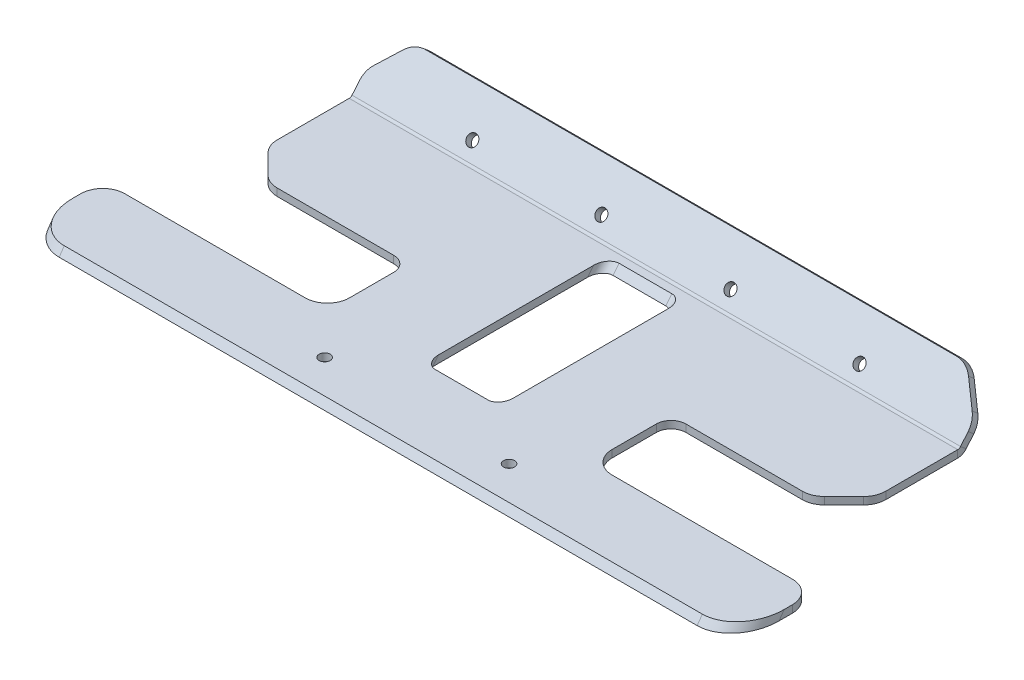
from build123d import *

# Parameters (mm, degrees)
SKETCH_1_W              = 165
SKETCH_1_H              = 108
EXTRUDE_1_DEPTH         = 3
SHEET_METAL_2_OUTLINE_W = 165
SHEET_METAL_2_OUTLINE_H = 108
SHEET_METAL_2_DEPTH     = 1
OTHER_START             = -82.5
OTHER_1_DEPTH           = 165
OTHER_1_2_DEPTH         = 165
SKETCH_14_W             = 50
SKETCH_14_H             = 35
CUT_EXTRUDE_1_DEPTH     = 2
FILLET_1_R              = 5
SKETCH_20_R             = 1.75
CUT_EXTRUDE_7_DEPTH     = 10
SKETCH_24_W             = 165
SKETCH_24_H             = 1
CUT_EXTRUDE_11_DEPTH    = 10
SKETCH_25_W             = 17
SKETCH_25_H             = 2
EXTRUDE_2_DEPTH         = 14
SKETCH_26_W             = 17
SKETCH_26_H             = 2
EXTRUDE_3_DEPTH         = 14
FILLET_6_R              = 10
SKETCH_27_R             = 2.25
CUT_EXTRUDE_12_DEPTH    = 10
SKETCH_28_R             = 1.75
CUT_EXTRUDE_13_DEPTH    = 113.27486947
SKETCH_29_W             = 15
SKETCH_29_H             = 12
CUT_EXTRUDE_14_DEPTH    = 10
FILLET_8_R              = 3
OTHER_START_2           = 3
OTHER_1_3_DEPTH         = 21
OTHER_START_3           = 1
OTHER_1_3_2_OUTLINE_R   = 1.75
OTHER_1_3_2_DEPTH       = 2
OTHER_START_4           = -42
OTHER_1_4_OUTLINE_R     = 1.75
OTHER_1_4_DEPTH         = 10.030896321
OTHER_1_4_2_DEPTH       = 165
OTHER_START_5           = -67.5
OTHER_1_4_3_DEPTH       = 135
OTHER_1_4_4_DEPTH       = 165
OTHER_START_6           = -20.806456798
OTHER_1_4_5_OUTLINE_R   = 1.75
OTHER_1_4_5_DEPTH       = 2
CUT_EXTRUDE_20_DEPTH    = 10
FILLET_9_R              = 3
EXTRUDE_4_DEPTH         = 2
EXTRUDE_5_DEPTH         = 2
CUT_EXTRUDE_21_REACH    = 133.427
SKETCH_34_W             = 20.3
SKETCH_34_H             = 38.2
SKETCH_38_R             = 2.25
SKETCH_38_R_2           = 1.75
EXTRUDE_6_DEPTH         = 2
CUT_EXTRUDE_23_DEPTH    = 10
EXTRUDE_START           = -2
SKETCH_47_R             = 1.75
EXTRUDE_9_DEPTH         = 2
CUT_EXTRUDE_27_DEPTH    = 10
FILLET_14_R             = 3.3
FILLET_17_R             = 3
SKETCH_51_W             = 12.822687145
SKETCH_51_H             = 2
EXTRUDE_12_DEPTH        = 24
SKETCH_56_W             = 8.820712464
SKETCH_56_H             = 2.159181397
SKETCH_56_W_2           = 10.112203134
EXTRUDE_13_DEPTH        = 2
SKETCH_55_W             = 243.511424265
SKETCH_55_H             = 14.236732763
CUT_EXTRUDE_29_DEPTH    = 123.832146316
CUT_EXTRUDE_30_REACH    = 112.932
SKETCH_58_W             = 44.071930239
SKETCH_58_H             = 30
CUT_EXTRUDE_33_REACH    = 119.8
SKETCH_62_W             = 205
SKETCH_62_H             = 60.625088721
FILLET_18_R             = 4
SKETCH_63_R             = 1.5
CUT_EXTRUDE_34_DEPTH    = 10
CUT_EXTRUDE_35_REACH    = 110.652
EXTRUDE_16_DEPTH        = 8
EXTRUDE_16_DEPTH_BACK   = 5
FILLET_23_R             = 6
FILLET_25_R             = 6
CUT_EXTRUDE_36_DEPTH    = 4
FILLET_26_R             = 6
FILLET_27_R             = 10
CUT_EXTRUDE_38_REACH    = 110.42
SKETCH_72_R             = 1.5


with BuildPart() as part:
    # 草图1 → 凸台-拉伸1 (new body)
    with BuildSketch(Plane(origin=(0, 0, 0), x_dir=(1, 0, 0), z_dir=(0, 1, 0))):
        Rectangle(SKETCH_1_W, SKETCH_1_H)
    extrude(amount=EXTRUDE_1_DEPTH)

    # Sheet Metal 2: read off the stored shape, not the designer's step
    # Sheet Metal 2 outline → Sheet Metal 2 (cut)
    with BuildSketch(Plane(origin=(0, 0, 0), x_dir=(1, 0, 0), z_dir=(0, 1, 0))):
        Rectangle(SHEET_METAL_2_OUTLINE_W, SHEET_METAL_2_OUTLINE_H)
    extrude(amount=SHEET_METAL_2_DEPTH, mode=Mode.SUBTRACT)

    # Other 1: read off the stored shape, not the designer's step
    # Other 1 outline → Other 1 (cut)
    with BuildSketch(Plane.YZ.offset(OTHER_START)):
        with BuildLine():
            Line((3, -54), (3, -29.678199262))
            Line((3, -29.678199262), (2.071637171, -28.899210355))
            ThreePointArc((2.071637171, -28.899210355), (1.281076639, -27.868931811), (1, -26.601077026))
            Line((1, -26.601077026), (1, -54))
            Line((1, -54), (3, -54))
        make_face()
    extrude(amount=OTHER_1_DEPTH, mode=Mode.SUBTRACT)

    # Other 1 2 outline → Other 1 2 (add)
    with BuildSketch(Plane.YZ.offset(OTHER_START)):
        with BuildLine():
            Line((3, -29.678199262), (21.723430088, -45.389022544))
            Line((21.723430088, -45.389022544), (23.009005307, -43.856933657))
            Line((23.009005307, -43.856933657), (3.35721239, -27.367121469))
            ThreePointArc((3.35721239, -27.367121469), (3.093692213, -27.023695287), (3, -26.601077026))
            Line((3, -26.601077026), (3, -29.678199262))
        make_face()
    extrude(amount=OTHER_1_2_DEPTH)

    # 草图14 → 切除-拉伸1 (cut)
    with BuildSketch(Plane.XZ.offset(-1)):
        with Locations((35, -1.601077026)):
            Rectangle(SKETCH_14_W, SKETCH_14_H)
        with Locations((-35, -1.601077026)):
            Rectangle(SKETCH_14_W, SKETCH_14_H)
    extrude(amount=-CUT_EXTRUDE_1_DEPTH, mode=Mode.SUBTRACT)

    # 圆角1
    fillet_1_edges = [part.edges().sort_by_distance(p)[0] for p in [
        (60, 2, 15.898922974),
        (60, 2, -19.101077026),
        (10, 2, -19.101077026),
        (10, 2, 15.898922974),
        (-10, 2, 15.898922974),
        (-10, 2, -19.101077026),
        (-60, 2, -19.101077026),
        (-60, 2, 15.898922974),
    ]]
    fillet(fillet_1_edges, radius=FILLET_1_R)

    # 草图20 → 切除-拉伸7 (cut)
    with BuildSketch(Plane(origin=(0, -12.088557412, -14.406581725), x_dir=(1, 0, 0), z_dir=(0, 0.6427876096865379, 0.7660444431189792))):
        with Locations(Location((-17.5, 37.816614211, 0), (0, 0, 270))):
            Circle(SKETCH_20_R)
        with Locations(Location((-52.5, 37.816614211, 0), (0, 0, 270))):
            Circle(SKETCH_20_R)
        with Locations(Location((17.5, 37.816614211, 0), (0, 0, 270))):
            Circle(SKETCH_20_R)
        with Locations(Location((52.5, 37.816614211, 0), (0, 0, 270))):
            Circle(SKETCH_20_R)
    extrude(amount=-CUT_EXTRUDE_7_DEPTH, mode=Mode.SUBTRACT)

    # 草图24 → 切除-拉伸11 (cut)
    with BuildSketch(Plane(origin=(0, 3, 0), x_dir=(1, 0, 0), z_dir=(0, 1, 0))):
        with Locations((0, -53.5)):
            Rectangle(SKETCH_24_W, SKETCH_24_H)
    extrude(amount=-CUT_EXTRUDE_11_DEPTH, mode=Mode.SUBTRACT)

    # 草图25 → 凸台-拉伸2 (add)
    with BuildSketch(Plane.ZY.offset(82.5)):
        with Locations((44.5, 2)):
            Rectangle(SKETCH_25_W, SKETCH_25_H)
    extrude(amount=EXTRUDE_2_DEPTH)

    # 草图26 → 凸台-拉伸3 (add)
    with BuildSketch(Plane(origin=(82.5, 0, 0), x_dir=(0, 0, -1), z_dir=(1, 0, 0))):
        with Locations((-44.5, 2)):
            Rectangle(SKETCH_26_W, SKETCH_26_H)
    extrude(amount=EXTRUDE_3_DEPTH)

    # 圆角6
    fillet_6_edges = [part.edges().sort_by_distance(p)[0] for p in [
        (-82.5, 2, 36),
        (82.5, 2, 36),
    ]]
    fillet(fillet_6_edges, radius=FILLET_6_R)

    # 草图27 → 切除-拉伸12 (cut)
    with BuildSketch(Plane(origin=(0, 3, 0), x_dir=(1, 0, 0), z_dir=(0, 1, 0))):
        with Locations(Location((-73.3, -43.8, 0), (0, 0, 270))):
            Circle(SKETCH_27_R)
        with Locations(Location((73.3, -43.8, 0), (0, 0, 270))):
            Circle(SKETCH_27_R)
    extrude(amount=-CUT_EXTRUDE_12_DEPTH, mode=Mode.SUBTRACT)

    # 草图28 → 切除-拉伸13 (cut, through all)
    with BuildSketch(Plane.XZ.offset(-1)):
        with Locations(Location((-70.5, 8.898922974, 0), (0, 0, 270))):
            Circle(SKETCH_28_R)
        with Locations(Location((70.5, 8.898922974, 0), (0, 0, 270))):
            Circle(SKETCH_28_R)
    extrude(amount=-CUT_EXTRUDE_13_DEPTH, mode=Mode.SUBTRACT)

    # 草图29 → 切除-拉伸14 (cut)
    with BuildSketch(Plane(origin=(0, -12.088557412, -14.406581725), x_dir=(1, 0, 0), z_dir=(0, 0.6427876096865379, 0.7660444431189792))):
        with Locations((-75, 39.816614211)):
            Rectangle(SKETCH_29_W, SKETCH_29_H)
        with Locations((75, 39.816614211)):
            Rectangle(SKETCH_29_W, SKETCH_29_H)
    extrude(amount=-CUT_EXTRUDE_14_DEPTH, mode=Mode.SUBTRACT)

    # 圆角8
    fillet_8_edges = [part.edges().sort_by_distance(p)[0] for p in [
        (-96.5, 2, 53),
        (-96.5, 2, 36),
        (96.5, 2, 53),
        (96.5, 2, 36),
    ]]
    fillet(fillet_8_edges, radius=FILLET_8_R)

    # Other 1 3: read off the stored shape, not the designer's step
    # Other 1 3 outline → Other 1 3 (cut)
    with BuildSketch(Plane(origin=(0, 0, 0), x_dir=(1, 0, 0), z_dir=(0, 1, 0)).offset(OTHER_START_2)):
        Polygon((-67.5, 42), (-82.5, 42), (-82.5, 25), (82.5, 25), (82.5, 42), (67.5, 42), (67.5, 54), (-67.5, 54), align=None)
    extrude(amount=OTHER_1_3_DEPTH, mode=Mode.SUBTRACT)

    # Other 1 3 2 outline → Other 1 3 2 (add)
    with BuildSketch(Plane(origin=(0, 0, 0), x_dir=(1, 0, 0), z_dir=(0, 1, 0)).offset(OTHER_START_3)):
        Polygon((-67.5, 42), (-82.5, 42), (-82.5, 25), (82.5, 25), (82.5, 42), (67.5, 42), (67.5, 54), (-67.5, 54), align=None)
        with Locations((17.5, 46)):
            Circle(OTHER_1_3_2_OUTLINE_R, mode=Mode.SUBTRACT)
        with Locations((52.5, 46)):
            Circle(OTHER_1_3_2_OUTLINE_R, mode=Mode.SUBTRACT)
        with Locations((-52.5, 46)):
            Circle(OTHER_1_3_2_OUTLINE_R, mode=Mode.SUBTRACT)
        with Locations((-17.5, 46)):
            Circle(OTHER_1_3_2_OUTLINE_R, mode=Mode.SUBTRACT)
    extrude(amount=OTHER_1_3_2_DEPTH)

    # Other 1 4: read off the stored shape, not the designer's step
    # Other 1 4 outline → Other 1 4 (cut)
    with BuildSketch(Plane(origin=(0, 0, 0), x_dir=(1, 0, 0), z_dir=(0, 0.6427876096865381, 0.7660444431189791)).offset(OTHER_START_4)):
        with Locations((-17.5, 37.816614211)):
            Circle(OTHER_1_4_OUTLINE_R)
        with Locations((-52.5, 37.816614211)):
            Circle(OTHER_1_4_OUTLINE_R)
        with Locations((17.5, 37.816614211)):
            Circle(OTHER_1_4_OUTLINE_R)
        with Locations((52.5, 37.816614211)):
            Circle(OTHER_1_4_OUTLINE_R)
    extrude(amount=OTHER_1_4_DEPTH, mode=Mode.SUBTRACT)

    # Other 1 4 2 outline → Other 1 4 2 (cut)
    with BuildSketch(Plane.YZ.offset(OTHER_START)):
        with BuildLine():
            Line((3, -29.678199262), (2.071637171, -28.899210355))
            ThreePointArc((2.071637171, -28.899210355), (1.281076639, -27.868931811), (1, -26.601077026))
            Line((1, -26.601077026), (1, -54))
            Line((1, -54), (3, -54))
            Line((3, -54), (3, -29.678199262))
        make_face()
    extrude(amount=OTHER_1_4_2_DEPTH, mode=Mode.SUBTRACT)

    # Other 1 4 3 outline → Other 1 4 3 (add)
    with BuildSketch(Plane.YZ.offset(OTHER_START_5)):
        with BuildLine():
            Line((21.723430088, -45.389022544), (23.009005307, -43.856933657))
            Line((23.009005307, -43.856933657), (3.35721239, -27.367121469))
            ThreePointArc((3.35721239, -27.367121469), (3.093692213, -27.023695287), (3, -26.601077026))
            Line((3, -26.601077026), (3, -29.678199262))
            Line((3, -29.678199262), (21.723430088, -45.389022544))
        make_face()
    extrude(amount=OTHER_1_4_3_DEPTH)

    # Other 1 4 4 outline → Other 1 4 4 (add)
    with BuildSketch(Plane.YZ.offset(OTHER_START)):
        with BuildLine():
            Line((3, -29.678199262), (12.530896771, -37.675571228))
            Line((12.530896771, -37.675571228), (13.81647199, -36.143482341))
            Line((13.81647199, -36.143482341), (3.35721239, -27.367121469))
            ThreePointArc((3.35721239, -27.367121469), (3.093692213, -27.023695287), (3, -26.601077026))
            Line((3, -26.601077026), (3, -29.678199262))
        make_face()
    extrude(amount=OTHER_1_4_4_DEPTH)

    # Other 1 4 5 outline → Other 1 4 5 (cut)
    with BuildSketch(Plane(origin=(0, 0, 0), x_dir=(1, 0, 0), z_dir=(0, 0.6427876096865381, 0.7660444431189791)).offset(OTHER_START_6)):
        with Locations((-17.5, 37.816614211)):
            Circle(OTHER_1_4_5_OUTLINE_R)
        with Locations((-52.5, 37.816614211)):
            Circle(OTHER_1_4_5_OUTLINE_R)
        with Locations((17.5, 37.816614211)):
            Circle(OTHER_1_4_5_OUTLINE_R)
        with Locations((52.5, 37.816614211)):
            Circle(OTHER_1_4_5_OUTLINE_R)
    extrude(amount=OTHER_1_4_5_DEPTH, mode=Mode.SUBTRACT)

    # 草图31 → 切除-拉伸20 (cut)
    with BuildSketch(Plane(origin=(0, -12.088557412, -14.406581725), x_dir=(1, 0, 0), z_dir=(0, 0.6427876096865379, 0.7660444431189792))):
        Polygon((0, 45.816614211), (8, 45.816614211), (8, 39.795572536), (-8, 39.795572536), (-8, 45.816614211), align=None)
    extrude(amount=-CUT_EXTRUDE_20_DEPTH, mode=Mode.SUBTRACT)

    # 圆角9
    fillet_9_edges = [part.edges().sort_by_distance(p)[0] for p in [
        (8, 17.753832181, -40.752727114),
        (-8, 17.753832181, -40.752727114),
    ]]
    fillet(fillet_9_edges, radius=FILLET_9_R)

    # 草图32 → 凸台-拉伸4 (add)
    with BuildSketch(Plane(origin=(0, 3, 0), x_dir=(1, 0, 0), z_dir=(0, 1, 0))):
        with BuildLine():
            Line((55, -15.898922974), (15, -15.898922974))
            ThreePointArc((15, -15.898922974), (11.464466094, -14.43445688), (10, -10.898922974))
            Line((10, -10.898922974), (10, 14.101077026))
            ThreePointArc((10, 14.101077026), (11.464466094, 17.636610931), (15, 19.101077026))
            Line((15, 19.101077026), (55, 19.101077026))
            ThreePointArc((55, 19.101077026), (58.535533906, 17.636610931), (60, 14.101077026))
            Line((60, 14.101077026), (60, -10.898922974))
            ThreePointArc((60, -10.898922974), (58.535533906, -14.43445688), (55, -15.898922974))
        make_face()
    extrude(amount=-EXTRUDE_4_DEPTH)

    # 草图33 → 凸台-拉伸5 (add)
    with BuildSketch(Plane(origin=(0, 3, 0), x_dir=(1, 0, 0), z_dir=(0, 1, 0))):
        with BuildLine():
            Line((-55, 19.101077026), (-15, 19.101077026))
            ThreePointArc((-15, 19.101077026), (-11.464466094, 17.636610931), (-10, 14.101077026))
            Line((-10, 14.101077026), (-10, -10.898922974))
            ThreePointArc((-10, -10.898922974), (-11.464466094, -14.43445688), (-15, -15.898922974))
            Line((-15, -15.898922974), (-55, -15.898922974))
            ThreePointArc((-55, -15.898922974), (-58.535533906, -14.43445688), (-60, -10.898922974))
            Line((-60, -10.898922974), (-60, 14.101077026))
            ThreePointArc((-60, 14.101077026), (-58.535533906, 17.636610931), (-55, 19.101077026))
        make_face()
    extrude(amount=-EXTRUDE_5_DEPTH)

    # 切除-拉伸21: up to this plane
    cut_extrude_21_end = Plane(origin=(0, 1, 0), z_dir=(0, 1, 0))
    # 草图34 → 切除-拉伸21 (cut, up to the surface)
    with BuildSketch(Plane(origin=(0, 35.097562719, -29.450351933), x_dir=(1, 0, 0), z_dir=(0, 0.7660444431189792, -0.6427876096865379)), mode=Mode.PRIVATE) as cut_extrude_21_sk1:
        with Locations((0, -2.293543202)):
            Rectangle(SKETCH_34_W, SKETCH_34_H)
    cut_extrude_21_tool1 = split(extrude(cut_extrude_21_sk1.sketch, amount=-CUT_EXTRUDE_21_REACH, mode=Mode.PRIVATE), bisect_by=cut_extrude_21_end, keep=Keep.BOTH, mode=Mode.PRIVATE)
    add(cut_extrude_21_tool1.solids().sort_by_distance((0, 36.571824, -27.693396))[0], mode=Mode.SUBTRACT)

    # 草图38 → 凸台-拉伸6 (add)
    with BuildSketch(Plane.XZ.offset(-1)):
        with Locations((-73.3, 43.8)):
            Circle(SKETCH_38_R)
        with Locations((-70.5, 8.898922974)):
            Circle(SKETCH_38_R_2)
        with Locations((70.5, 8.898922974)):
            Circle(SKETCH_38_R_2)
        with Locations((73.3, 43.8)):
            Circle(SKETCH_38_R)
    extrude(amount=-EXTRUDE_6_DEPTH)

    # 草图41 → 切除-拉伸23 (cut)
    with BuildSketch(Plane.XZ.offset(-1)):
        Polygon((-79.183967725, 34.214311054), (-56.85462571, 34.214311054), (-56.85462571, 14.214311054), (-78.010881611, 14.214311054), (-82.5, 14.214311054), (-86.796922418, 34.214311054), align=None)
        Polygon((86.796922418, 34.214311054), (82.5, 14.214311054), (78.010881611, 14.214311054), (56.85462571, 14.214311054), (56.85462571, 34.214311054), (79.183967725, 34.214311054), align=None)
    extrude(amount=-CUT_EXTRUDE_23_DEPTH, mode=Mode.SUBTRACT)

    # 草图47 → 凸台-拉伸9 (add)
    with BuildSketch(Plane(origin=(0, -12.088557412, -14.406581725), x_dir=(1, 0, 0), z_dir=(0, 0.6427876096865379, 0.7660444431189792)).offset(EXTRUDE_START)):
        with Locations((-52.5, 37.816614211)):
            Circle(SKETCH_47_R)
        with Locations((-17.5, 38.795572536)):
            Circle(SKETCH_47_R)
        with Locations((17.5, 37.816614211)):
            Circle(SKETCH_47_R)
        with Locations((52.5, 37.816614211)):
            Circle(SKETCH_47_R)
    extrude(amount=EXTRUDE_9_DEPTH)

    # 草图50 → 切除-拉伸27 (cut)
    with BuildSketch(Plane(origin=(0, 3, 0), x_dir=(1, 0, 0), z_dir=(0, 1, 0))):
        Polygon((-69.677312855, -14.214311054), (-82.5, -1.391623909), (-82.5, -14.214311054), align=None)
    cut_extrude_27 = extrude(amount=-CUT_EXTRUDE_27_DEPTH, mode=Mode.SUBTRACT)

    # 圆角14
    fillet_14_edges = [part.edges().sort_by_distance(p)[0] for p in [
        (-82.5, 2, 1.391623909),
    ]]
    fillet(fillet_14_edges, radius=FILLET_14_R)

    # 镜向3: 切除-拉伸27 across plane
    add(cut_extrude_27.mirror(Plane(origin=(0, 0, 0), x_dir=(0, 0, 1), z_dir=(1, 0, 0))), mode=Mode.SUBTRACT)

    # 圆角17
    fillet_17_edges = [part.edges().sort_by_distance(p)[0] for p in [
        (-10.15, 2, 26.249087979),
        (-10.15, 2, -23.617470474),
        (10.15, 2, -23.617470474),
        (10.15, 2, 26.249087979),
    ]]
    fillet(fillet_17_edges, radius=FILLET_17_R)

    # 草图51 → 凸台-拉伸12 (add)
    with BuildSketch(Plane.XY.offset(14.214311054)):
        with Locations((-63.265969283, 2)):
            Rectangle(SKETCH_51_W, SKETCH_51_H)
    extrude_12 = extrude(amount=EXTRUDE_12_DEPTH)

    # 镜向4: 凸台-拉伸12 across plane
    add(extrude_12.mirror(Plane(origin=(0, 0, 0), x_dir=(0, 0, 1), z_dir=(1, 0, 0))))

    # 草图56 → 凸台-拉伸13 (add)
    with BuildSketch(Plane(origin=(0, -12.088557412, -14.406581725), x_dir=(1, 0, 0), z_dir=(0, 0.6427876096865379, 0.7660444431189792))):
        with Locations((-71.910356232, 34.896204909)):
            Rectangle(SKETCH_56_W, SKETCH_56_H)
        with Locations((72.556101567, 34.896204909)):
            Rectangle(SKETCH_56_W_2, SKETCH_56_H)
    extrude(amount=-EXTRUDE_13_DEPTH)

    # 草图55 → 切除-拉伸29 (cut, through all)
    with BuildSketch(Plane(origin=(0, -12.088557412, -14.406581725), x_dir=(1, 0, 0), z_dir=(0, 0.6427876096865379, 0.7660444431189792))):
        with Locations((-3.841223904, 41.947458337)):
            Rectangle(SKETCH_55_W, SKETCH_55_H)
    extrude(amount=-CUT_EXTRUDE_29_DEPTH, mode=Mode.SUBTRACT)

    # 草图58 → 切除-拉伸30 (cut, up to next)
    with BuildSketch(Plane.XZ.offset(-1), mode=Mode.PRIVATE) as cut_extrude_30_sk1:
        Polygon((35.605382616, 4.214311054), (79.677312855, 4.214311054), (69.677312855, 14.214311054), (69.677312855, 34.214311054), (35.605382616, 34.214311054), align=None)
    cut_extrude_30_tool1 = extrude(cut_extrude_30_sk1.sketch, amount=-CUT_EXTRUDE_30_REACH, mode=Mode.PRIVATE) & part.part
    # 草图58 → 切除-拉伸30 (cut, up to next)
    with BuildSketch(Plane.XZ.offset(-1), mode=Mode.PRIVATE) as cut_extrude_30_sk2:
        with Locations((-57.641347736, 19.214311054)):
            Rectangle(SKETCH_58_W, SKETCH_58_H)
    cut_extrude_30_tool2 = extrude(cut_extrude_30_sk2.sketch, amount=-CUT_EXTRUDE_30_REACH, mode=Mode.PRIVATE) & part.part
    add(cut_extrude_30_tool1.solids().sort_by_distance((53.591268, 1, 18.670237))[0], mode=Mode.SUBTRACT)
    add(cut_extrude_30_tool2.solids().sort_by_distance((-57.641348, 1, 19.214311))[0], mode=Mode.SUBTRACT)

    # 草图62 → 切除-拉伸33 (cut, up to next)
    with BuildSketch(Plane(origin=(0, -24.230844379, 16.966619891), x_dir=(-1, 0, 0), z_dir=(0, -0.819152044288991, 0.5735764363510473)), mode=Mode.PRIVATE) as cut_extrude_33_sk1:
        with Locations((0.35, -70.241285348)):
            Rectangle(SKETCH_62_W, SKETCH_62_H)
    cut_extrude_33_tool1 = extrude(cut_extrude_33_sk1.sketch, amount=-CUT_EXTRUDE_33_REACH, mode=Mode.PRIVATE) & part.part
    add(cut_extrude_33_tool1.solids().sort_by_distance((-0.35, 16.057902, 74.504912))[0], mode=Mode.SUBTRACT)

    # 圆角18
    fillet_18_edges = [part.edges().sort_by_distance(p)[0] for p in [
        (35.605382616, 2, 34.214311054),
        (-35.605382616, 2, 34.214311054),
        (-35.605382616, 2, 4.214311054),
        (35.605382616, 2, 4.214311054),
    ]]
    fillet(fillet_18_edges, radius=FILLET_18_R)

    # 草图63 → 切除-拉伸34 (cut)
    with BuildSketch(Plane(origin=(0, -13.374132631, -15.938670611), x_dir=(-1, 0, 0), z_dir=(0, -0.6427876096865379, -0.7660444431189792))):
        with Locations(Location((-52.5, 24.235731917, 0), (0, 0, 90))):
            Circle(SKETCH_63_R)
        with Locations(Location((-17.5, 24.235731917, 0), (0, 0, 90))):
            Circle(SKETCH_63_R)
        with Locations(Location((17.5, 24.235731917, 0), (0, 0, 90))):
            Circle(SKETCH_63_R)
        with Locations(Location((52.5, 24.235731917, 0), (0, 0, 90))):
            Circle(SKETCH_63_R)
    extrude(amount=-CUT_EXTRUDE_34_DEPTH, mode=Mode.SUBTRACT)

    # 草图64 → 切除-拉伸35 (cut, up to next)
    with BuildSketch(Plane.XZ.offset(-1), mode=Mode.PRIVATE) as cut_extrude_35_sk1:
        Polygon((73.677312855, 4.214311054), (82.5, -4.608376091), (82.5, 4.214311054), align=None)
    cut_extrude_35_tool1 = extrude(cut_extrude_35_sk1.sketch, amount=-CUT_EXTRUDE_35_REACH, mode=Mode.PRIVATE) & part.part
    # 草图64 → 切除-拉伸35 (cut, up to next)
    with BuildSketch(Plane.XZ.offset(-1), mode=Mode.PRIVATE) as cut_extrude_35_sk2:
        Polygon((-73.677312855, 4.214311054), (-82.5, -4.608376091), (-82.5, 4.214311054), align=None)
    cut_extrude_35_tool2 = extrude(cut_extrude_35_sk2.sketch, amount=-CUT_EXTRUDE_35_REACH, mode=Mode.PRIVATE) & part.part
    add(cut_extrude_35_tool1.solids().sort_by_distance((79.559104, 1, 1.273415))[0], mode=Mode.SUBTRACT)
    add(cut_extrude_35_tool2.solids().sort_by_distance((-79.559104, 1, 1.273415))[0], mode=Mode.SUBTRACT)

    # 草图67 → 凸台-拉伸16 (add, two sides: drawn at the far end of the back side and taken through both)
    with BuildSketch(Plane(origin=(0, 0, 34.214311054), x_dir=(-1, 0, 0), z_dir=(0, 0, -1)).offset(-EXTRUDE_16_DEPTH_BACK)):
        Polygon((-93.5, 3), (-92.5, 3), (-86.796922418, 3), (-69.677312855, 3), (-39.605382616, 3), (-35.605382616, 3), (-35.605382616, 1), (-39.605382616, 1), (-69.677312855, 1), (-86.796922418, 1), (-92.5, 1), (-93.5, 1), (-96.5, 1), (-96.5, 3), align=None)
        Polygon((69.677312855, 3), (39.605382616, 3), (35.605382616, 3), (35.605382616, 1), (39.605382616, 1), (69.677312855, 1), (86.796922418, 1), (92.5, 1), (93.5, 1), (96.5, 1), (96.5, 3), (93.5, 3), (92.5, 3), (86.796922418, 3), align=None)
    extrude(amount=EXTRUDE_16_DEPTH + EXTRUDE_16_DEPTH_BACK)

    # 圆角23
    fillet_23_edges = [part.edges().sort_by_distance(p)[0] for p in [
        (-35.605382616, 2, 26.214311054),
        (-96.5, 2, 26.214311054),
        (96.5, 2, 26.214311054),
        (35.605382616, 2, 26.214311054),
    ]]
    fillet(fillet_23_edges, radius=FILLET_23_R)

    # 圆角25
    # the kernel refuses this fillet: 6 mm, written as the material it adds along each edge
    with BuildSketch(Plane(origin=(-76.320712464, 13.81647199, -36.143482341), x_dir=(-1.0, 8.907019491368926e-11, -7.473874667401355e-11), z_dir=(0, -0.6427876096865379, -0.7660444431189792))) as fillet_25_piece_1:
        with BuildLine():
            CenterArc((3.335359313, 6), FILLET_25_R, 236.227740467, 33.772259527)
            Line((0, 1.012477744), (0, 0))
            Line((0, 0), (3.335359312, 0))
        make_face()
    extrude(amount=2)
    # the kernel refuses this fillet: 6 mm, written as the material it takes off along each edge
    with BuildSketch(Plane(origin=(82.5, -5.213203436, -4.608376091), x_dir=(0, 0, -1), z_dir=(0, 1, 0)), Plane(origin=(73.677312855, -5.213203436, 4.214311054), x_dir=(0.707106781186546, 0, -0.7071067811865489), z_dir=(0, 1, 0)), Plane(origin=(-82.5, -5.213203436, -4.608376091), x_dir=(0.7071067811865464, 0, 0.7071067811865486), z_dir=(0, 1, 0)), Plane(origin=(-73.677312855, -5.213203436, 4.214311054), x_dir=(1, 0, 0), z_dir=(0, 1, 0))) as fillet_25_2_piece_1:
        with BuildLine():
            CenterArc((FILLET_25_R * 0.414213562373, FILLET_25_R), FILLET_25_R, 225, 45)
            Line((-FILLET_25_R * 0.292893218813, FILLET_25_R * 0.292893218813), (0, 0))
            Line((0, 0), (FILLET_25_R * 0.414213562373, 0))
        make_face()
    extrude(amount=14.426406871, mode=Mode.SUBTRACT)

    # 草图69 → 切除-拉伸36 (cut)
    with BuildSketch(Plane(origin=(0, -13.374132631, -15.938670611), x_dir=(-1, 0, 0), z_dir=(0, -0.6427876096865379, -0.7660444431189792))):
        Polygon((-82.5, 25.536955804), (-74.852049824, 34.829091955), (-83.09997169, 34.829091955), align=None)
        Polygon((83.09997169, 34.829091955), (82.5, 25.536955804), (74.852049824, 34.829091955), align=None)
    extrude(amount=-CUT_EXTRUDE_36_DEPTH, mode=Mode.SUBTRACT)

    # 圆角26
    fillet_26_edges = [part.edges().sort_by_distance(p)[0] for p in [
        (74.852049824, 13.94928733, -37.560334933),
        (82.5, 6.831098067, -31.587464948),
        (-74.852049824, 13.94928733, -37.560334933),
        (-82.5, 6.831098067, -31.587464948),
    ]]
    fillet(fillet_26_edges, radius=FILLET_26_R)

    # 圆角27
    # the kernel refuses this fillet: 10 mm, written as the material it takes off along each edge
    with BuildSketch(Plane(origin=(96.5, -19.478801107, 62.383195729), x_dir=(-1, 0, 0), z_dir=(0, 0.819152044288991, -0.5735764363510473)), Plane(origin=(-96.5, -19.478801107, 62.383195729), x_dir=(0, -0.5735764363510473, -0.819152044288991), z_dir=(0, 0.819152044288991, -0.5735764363510473))) as fillet_27_piece_1:
        with BuildLine():
            CenterArc((FILLET_27_R, -FILLET_27_R), FILLET_27_R, 90, 90)
            Line((0, -FILLET_27_R), (0, 0))
            Line((0, 0), (FILLET_27_R, 0))
        make_face()
    extrude(amount=52.441549178, mode=Mode.SUBTRACT)

    # 草图72 → 切除-拉伸38 (cut, up to next)
    with BuildSketch(Plane(origin=(0, 3, 0), x_dir=(1, 0, 0), z_dir=(0, 1, 0)), mode=Mode.PRIVATE) as cut_extrude_38_sk1:
        with Locations(Location((-25.000820268, -37.552871048, 0), (0, 0, 270))):
            Circle(SKETCH_72_R)
    cut_extrude_38_tool1 = extrude(cut_extrude_38_sk1.sketch, amount=-CUT_EXTRUDE_38_REACH, mode=Mode.PRIVATE) & part.part
    # 草图72 → 切除-拉伸38 (cut, up to next)
    with BuildSketch(Plane(origin=(0, 3, 0), x_dir=(1, 0, 0), z_dir=(0, 1, 0)), mode=Mode.PRIVATE) as cut_extrude_38_sk2:
        with Locations(Location((25.000820268, -37.552871048, 0), (0, 0, 270))):
            Circle(SKETCH_72_R)
    cut_extrude_38_tool2 = extrude(cut_extrude_38_sk2.sketch, amount=-CUT_EXTRUDE_38_REACH, mode=Mode.PRIVATE) & part.part
    add(cut_extrude_38_tool1.solids().sort_by_distance((-25.00082, 3, 37.552871))[0], mode=Mode.SUBTRACT)
    add(cut_extrude_38_tool2.solids().sort_by_distance((25.00082, 3, 37.552871))[0], mode=Mode.SUBTRACT)


solid = part.part
